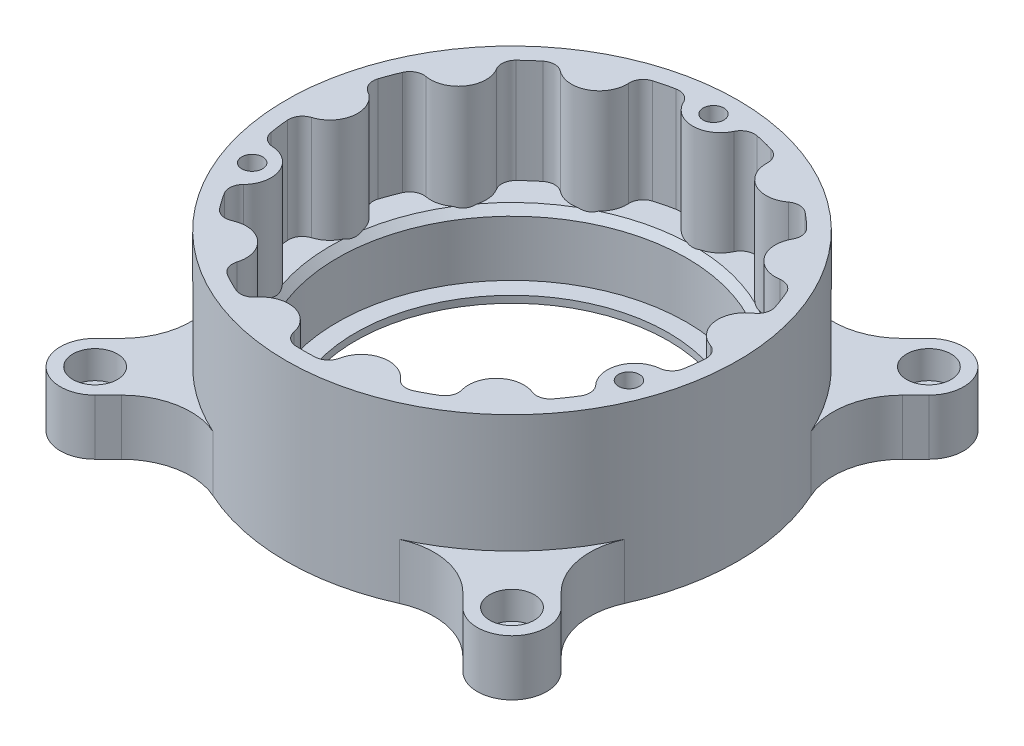
from build123d import *

# Parameters (mm, degrees)
SKETCH1_R           = 32.5
SKETCH1_R_2         = 25.125
BOSS_EXTRUDE1_DEPTH = 9
SKETCH2_R           = 32.5
BOSS_EXTRUDE2_DEPTH = 15
BOSS_EXTRUDE3_START = 1
SKETCH3_R           = 32.5
SKETCH3_R_2         = 22.5
BOSS_EXTRUDE3_DEPTH = 1
SKETCH6_R           = 1.5
CUT_EXTRUDE1_DEPTH  = 8
CHAMFER1_SIZE       = 1
SKETCH7_R           = 1.5
CUT_EXTRUDE2_DEPTH  = 10
SKETCH8_R           = 2.2
BOSS_EXTRUDE4_DEPTH = 8
CUT_EXTRUDE3_START  = -4
SKETCH9_R           = 3.2
SKETCH9_R_2         = 2.2
CUT_EXTRUDE3_DEPTH  = 4


with BuildPart() as part:
    # Sketch1 → Boss-Extrude1 (new body)
    with BuildSketch(Plane(origin=(0, 0, 0), x_dir=(1, 0, 0), z_dir=(0, 1, 0))):
        with Locations(Location((0, 0, 0), (0, 0, 270))):
            Circle(SKETCH1_R)
        with Locations(Location((0, 0, 0), (0, 0, 270))):
            Circle(SKETCH1_R_2, mode=Mode.SUBTRACT)
    extrude(amount=BOSS_EXTRUDE1_DEPTH)

    # Sketch2 → Boss-Extrude2 (add)
    with BuildSketch(Plane(origin=(0, 9, 0), x_dir=(1, 0, 0), z_dir=(0, 1, 0))):
        with Locations(Location((0, 0, 0), (0, 0, 270))):
            Circle(SKETCH2_R)
        with BuildLine():
            ThreePointArc((-25.375540297, 12.992628628), (-26.682507709, 12.788520024), (-27.576202028, 11.813258725))
            ThreePointArc((-27.576202028, 11.813258725), (-28.08632274, 10.543171957), (-28.537981973, 9.251139653))
            ThreePointArc((-28.537981973, 9.251139653), (-28.506017977, 7.926601241), (-27.653144071, 6.912683196))
            ThreePointArc((-27.653144071, 6.912683196), (-25.715566197, 3.004994308), (-28.501905004, -0.350680963))
            ThreePointArc((-28.501905004, -0.350680963), (-29.565571278, -1.14064157), (-29.902062044, -2.422124175))
            ThreePointArc((-29.902062044, -2.422124175), (-29.760395709, -3.78402527), (-29.55673371, -5.138043635))
            ThreePointArc((-29.55673371, -5.138043635), (-28.912687641, -6.292389316), (-27.689232569, -6.792856074))
            ThreePointArc((-27.689232569, -6.792856074), (-24.164380437, -9.34480545), (-25.055107923, -13.604339781))
            ThreePointArc((-25.055107923, -13.604339781), (-25.623509865, -14.797750239), (-25.3233191, -16.085071021))
            ThreePointArc((-25.3233191, -16.085071021), (-24.559413902, -17.228905618), (-23.743881848, -18.336522974))
            ThreePointArc((-23.743881848, -18.336522974), (-22.643370415, -19.055035483), (-21.334530217, -18.935356836))
            ThreePointArc((-21.334530217, -18.935356836), (-17.053259578, -19.562696569), (-15.8477038, -23.718351594))
            ThreePointArc((-15.8477038, -23.718351594), (-15.78770211, -25.031281691), (-14.925767965, -26.023478835))
            ThreePointArc((-14.925767965, -26.023478835), (-13.70757552, -26.685246361), (-12.460110867, -27.290028164))
            ThreePointArc((-12.460110867, -27.290028164), (-11.162191159, -27.41534755), (-10.062885956, -26.714042632))
            ThreePointArc((-10.062885956, -26.714042632), (-6.006174817, -25.308834281), (-3.013433793, -28.386985826))
            ThreePointArc((-3.013433793, -28.386985826), (-2.346463547, -29.507455017), (-1.130634176, -29.978686869))
            ThreePointArc((-1.130634176, -29.978686869), (0.269011361, -29.998793857), (1.668071226, -29.953589741))
            ThreePointArc((1.668071226, -29.953589741), (2.866663541, -29.4681174), (3.517660179, -28.35074982))
            ThreePointArc((3.517660179, -28.35074982), (6.449772908, -25.263196213), (10.503100969, -26.567344966))
            ThreePointArc((10.503100969, -26.567344966), (11.610050121, -27.235903494), (12.894672495, -27.087403368))
            ThreePointArc((12.894672495, -27.087403368), (14.155670345, -26.450274045), (15.385273288, -25.754482442))
            ThreePointArc((15.385273288, -25.754482442), (16.218028064, -24.776571764), (16.284274135, -23.49383981))
            ThreePointArc((16.284274135, -23.49383981), (17.460149184, -19.431184393), (21.624968359, -18.69488798))
            ThreePointArc((21.624968359, -18.69488798), (22.907456533, -18.765696839), (23.968531862, -18.041881287))
            ThreePointArc((23.968531862, -18.041881287), (24.796601794, -16.885749597), (25.568952651, -15.691674873))
            ThreePointArc((25.568952651, -15.691674873), (25.854181872, -14.444088066), (25.324662608, -13.278996696))
            ThreePointArc((25.324662608, -13.278996696), (24.497951908, -9.146735151), (27.830545419, -6.567421958))
            ThreePointArc((27.830545419, -6.567421958), (28.994063974, -6.034455616), (29.596264311, -4.905215472))
            ThreePointArc((29.596264311, -4.905215472), (29.795811373, -3.494227329), (29.928128935, -2.075355018))
            ThreePointArc((29.928128935, -2.075355018), (29.603243622, -0.836988867), (28.593901088, -0.049379292))
            ThreePointArc((28.593901088, -0.049379292), (25.946528984, 3.231499222), (27.708278474, 7.061509876))
            ThreePointArc((27.708278474, 7.061509876), (28.493598385, 8.072634908), (28.504806877, 9.352859717))
            ThreePointArc((28.504806877, 9.352859717), (28.030019575, 10.691959717), (27.492363687, 12.0070787))
            ThreePointArc((27.492363687, 12.0070787), (26.626266262, 12.957446372), (25.360590803, 13.184138003))
            ThreePointArc((25.360590803, 13.184138003), (21.473663534, 14.862737893), (21.271662929, 19.091815445))
            ThreePointArc((21.271662929, 19.091815445), (21.505287491, 20.356229549), (20.920872462, 21.501560302))
            ThreePointArc((20.920872462, 21.501560302), (19.887045308, 22.461198297), (18.809252235, 23.371179482))
            ThreePointArc((18.809252235, 23.371179482), (17.591752027, 23.812768672), (16.358967377, 23.41584327))
            ThreePointArc((16.358967377, 23.41584327), (12.107995006, 23.079194553), (9.968995377, 26.768202421))
            ThreePointArc((9.968995377, 26.768202421), (9.59494417, 28.008119137), (8.539654378, 28.758899546))
            ThreePointArc((8.539654378, 28.758899546), (7.191351989, 29.125323287), (5.827450873, 29.428571429))
            ThreePointArc((5.827450873, 29.428571429), (4.533707828, 29.250070463), (3.625969432, 28.311111111))
            ThreePointArc((3.625969432, 28.311111111), (0, 26), (-3.625969432, 28.311111111))
            ThreePointArc((-3.625969432, 28.311111111), (-4.533707828, 29.250070463), (-5.827450873, 29.428571429))
            ThreePointArc((-5.827450873, 29.428571429), (-7.178556115, 29.128479742), (-8.514382675, 28.766391634))
            ThreePointArc((-8.514382675, 28.766391634), (-9.583131408, 27.998536245), (-9.943401377, 26.732822493))
            ThreePointArc((-9.943401377, 26.732822493), (-12.074887525, 22.960907587), (-16.390567408, 23.342329134))
            ThreePointArc((-16.390567408, 23.342329134), (-17.637578721, 23.762791425), (-18.875899512, 23.317384451))
            ThreePointArc((-18.875899512, 23.317384451), (-19.923687981, 22.428701639), (-20.929689442, 21.49297792))
            ThreePointArc((-20.929689442, 21.49297792), (-21.518876674, 20.308628924), (-21.239932465, 19.015565017))
            ThreePointArc((-21.239932465, 19.015565017), (-21.353557542, 14.662273368), (-25.375540297, 12.992628628))
        make_face(mode=Mode.SUBTRACT)
    extrude(amount=BOSS_EXTRUDE2_DEPTH)

    # Sketch3 → Boss-Extrude3 (add)
    with BuildSketch(Plane(origin=(0, 0, 0), x_dir=(-1, 0, 0), z_dir=(0, -1, 0)).offset(BOSS_EXTRUDE3_START)):
        with Locations(Location((0, 0, 0), (0, 0, 90))):
            Circle(SKETCH3_R)
        with Locations(Location((0, 0, 0), (0, 0, 90))):
            Circle(SKETCH3_R_2, mode=Mode.SUBTRACT)
    extrude(amount=-BOSS_EXTRUDE3_DEPTH)

    # Sketch6 → Cut-Extrude1 (cut)
    with BuildSketch(Plane(origin=(0, -1, 0), x_dir=(-1, 0, 0), z_dir=(0, -1, 0))):
        with Locations(Location((0, -27.5, 0), (0, 0, 90))):
            Circle(SKETCH6_R)
        with Locations(Location((-19.445436483, -19.445436483, 0), (0, 0, 90))):
            Circle(SKETCH6_R)
        with Locations(Location((-27.5, 0, 0), (0, 0, 90))):
            Circle(SKETCH6_R)
        with Locations(Location((-19.445436483, 19.445436483, 0), (0, 0, 90))):
            Circle(SKETCH6_R)
        with Locations(Location((0, 27.5, 0), (0, 0, 90))):
            Circle(SKETCH6_R)
        with Locations(Location((19.445436483, 19.445436483, 0), (0, 0, 90))):
            Circle(SKETCH6_R)
        with Locations(Location((27.5, 0, 0), (0, 0, 90))):
            Circle(SKETCH6_R)
        with Locations(Location((19.445436483, -19.445436483, 0), (0, 0, 90))):
            Circle(SKETCH6_R)
    extrude(amount=-CUT_EXTRUDE1_DEPTH, mode=Mode.SUBTRACT)

    # Chamfer1
    # the kernel refuses this chamfer: 1 mm, written as the material it takes off along each edge
    with BuildSketch(Plane(origin=(0, 9, 0), x_dir=(0, 0, 1), z_dir=(-1, 0, 0))) as chamfer1_piece_1_section:
        Polygon((25.125 + CHAMFER1_SIZE, 0), (25.125, -CHAMFER1_SIZE), (25.125, 0), align=None)
    chamfer1_piece_1 = revolve(axis=Axis((0, 9, 0), (0, 1, 0)), mode=Mode.PRIVATE)
    chamfer1_piece_1 = chamfer1_piece_1 - Plane(origin=(20.133645602, 8.530446202, 22.406485538), x_dir=(-0.9623428666303805, 0, 0.27183856798773404), z_dir=(0, -1, 0)) * Cylinder(4, 105, mode=Mode.PRIVATE)
    chamfer1_piece_1 = chamfer1_piece_1 - Plane(origin=(7.439247582, 8.530446202, 29.138881942), x_dir=(-0.9803968506900749, 0, -0.1970330306242669), z_dir=(0, -1, 0)) * Cylinder(4, 105, mode=Mode.PRIVATE)
    chamfer1_piece_1 = chamfer1_piece_1 - Plane(origin=(-6.92978425, 8.530446202, 29.20074199), x_dir=(-0.7832754265463859, 0, -0.6216748395814143), z_dir=(0, -1, 0)) * Cylinder(4, 105, mode=Mode.PRIVATE)
    chamfer1_piece_1 = chamfer1_piece_1 - Plane(origin=(-19.681677866, 8.530446202, 22.577894291), x_dir=(-0.4132130876365111, 0, -0.9106343636201639), z_dir=(0, -1, 0)) * Cylinder(4, 105, mode=Mode.PRIVATE)
    chamfer1_piece_1 = chamfer1_piece_1 - Plane(origin=(-27.895128116, 8.530446202, 10.787553437), x_dir=(0.05147388661387087, 0, -0.9986743408122902), z_dir=(0, -1, 0)) * Cylinder(4, 105, mode=Mode.PRIVATE)
    chamfer1_piece_1 = chamfer1_piece_1 - Plane(origin=(-29.68853253, 8.530446202, -3.469255569), x_dir=(0.5088471146837801, 0, -0.8608569067376948), z_dir=(0, -1, 0)) * Cylinder(4, 105, mode=Mode.PRIVATE)
    chamfer1_piece_1 = chamfer1_piece_1 - Plane(origin=(-24.65104377, 8.530446202, -16.926469599), x_dir=(0.8527778262980071, 0, -0.5222738543852701), z_dir=(0, -1, 0)) * Cylinder(4, 105, mode=Mode.PRIVATE)
    chamfer1_piece_1 = chamfer1_piece_1 - Plane(origin=(-13.936689803, 8.530446202, -26.501203095), x_dir=(0.9983221065340072, 0, -0.05790484958535382), z_dir=(0, -1, 0)) * Cylinder(4, 105, mode=Mode.PRIVATE)
    chamfer1_piece_1 = chamfer1_piece_1 - Plane(origin=(0, 8.530446202, -30), x_dir=(0.9064923579720502, 0, 0.4222222222222233), z_dir=(0, -1, 0)) * Cylinder(4, 105, mode=Mode.PRIVATE)
    chamfer1_piece_1 = chamfer1_piece_1 - Plane(origin=(13.96629796, 8.530446202, -26.62132811), x_dir=(0.5981673543401665, 0, 0.8013712099905297), z_dir=(0, -1, 0)) * Cylinder(4, 105, mode=Mode.PRIVATE)
    chamfer1_piece_1 = chamfer1_piece_1 - Plane(origin=(24.762693526, 8.530446202, -17.139200436), x_dir=(0.14947431915059115, 0, 0.9887656081774221), z_dir=(0, -1, 0)) * Cylinder(4, 105, mode=Mode.PRIVATE)
    add(chamfer1_piece_1, mode=Mode.SUBTRACT)

    # Sketch7 → Cut-Extrude2 (cut)
    with BuildSketch(Plane(origin=(0, 24, 0), x_dir=(1, 0, 0), z_dir=(0, 1, 0))):
        with Locations(Location((0, 29, 0), (0, 0, 270))):
            Circle(SKETCH7_R)
        with Locations(Location((-27.115471038, -10.283541724, 0), (0, 0, 270))):
            Circle(SKETCH7_R)
        with Locations(Location((27.115471038, -10.283541724, 0), (0, 0, 270))):
            Circle(SKETCH7_R)
    extrude(amount=-CUT_EXTRUDE2_DEPTH, mode=Mode.SUBTRACT)

    # Sketch8 → Boss-Extrude4 (add)
    # profile 1 of 4: a face of its own
    with BuildSketch(Plane.XZ.offset(1)):
        with BuildLine():
            Line((-33.535533906, 26.464466094), (-31.653588604, 24.582520792))
            ThreePointArc((-31.653588604, 24.582520792), (-28.886858103, 19.305254628), (-29.612972553, 13.391111103))
            ThreePointArc((-29.612972553, 13.391111103), (-22.980970389, 22.980970389), (-13.391111103, 29.612972553))
            ThreePointArc((-13.391111103, 29.612972553), (-19.305254628, 28.886858103), (-24.582520792, 31.653588604))
            Line((-24.582520792, 31.653588604), (-26.464466094, 33.535533906))
            ThreePointArc((-26.464466094, 33.535533906), (-33.535533906, 33.535533906), (-33.535533906, 26.464466094))
        make_face()
        with Locations(Location((-30, 30, 0), (0, 0, 270))):
            Circle(SKETCH8_R, mode=Mode.SUBTRACT)
    # profile 2 of 4: a face of its own
    with BuildSketch(Plane.XZ.offset(1)):
        with BuildLine():
            Line((26.464466094, 33.535533906), (24.582520792, 31.653588604))
            ThreePointArc((24.582520792, 31.653588604), (19.305254628, 28.886858103), (13.391111103, 29.612972553))
            ThreePointArc((13.391111103, 29.612972553), (22.980970389, 22.980970389), (29.612972553, 13.391111103))
            ThreePointArc((29.612972553, 13.391111103), (28.886858103, 19.305254628), (31.653588604, 24.582520792))
            Line((31.653588604, 24.582520792), (33.535533906, 26.464466094))
            ThreePointArc((33.535533906, 26.464466094), (33.535533906, 33.535533906), (26.464466094, 33.535533906))
        make_face()
        with Locations(Location((30, 30, 0), (0, 0, 270))):
            Circle(SKETCH8_R, mode=Mode.SUBTRACT)
    # profile 3 of 4: a face of its own
    with BuildSketch(Plane.XZ.offset(1)):
        with BuildLine():
            Line((33.535533906, -26.464466094), (31.653588604, -24.582520792))
            ThreePointArc((31.653588604, -24.582520792), (28.886858103, -19.305254628), (29.612972553, -13.391111103))
            ThreePointArc((29.612972553, -13.391111103), (22.980970389, -22.980970389), (13.391111103, -29.612972553))
            ThreePointArc((13.391111103, -29.612972553), (19.305254628, -28.886858103), (24.582520792, -31.653588604))
            Line((24.582520792, -31.653588604), (26.464466094, -33.535533906))
            ThreePointArc((26.464466094, -33.535533906), (33.535533906, -33.535533906), (33.535533906, -26.464466094))
        make_face()
        with Locations(Location((30, -30, 0), (0, 0, 270))):
            Circle(SKETCH8_R, mode=Mode.SUBTRACT)
    # profile 4 of 4: a face of its own
    with BuildSketch(Plane.XZ.offset(1)):
        with BuildLine():
            Line((-26.464466094, -33.535533906), (-24.582520792, -31.653588604))
            ThreePointArc((-24.582520792, -31.653588604), (-19.305254628, -28.886858103), (-13.391111103, -29.612972553))
            ThreePointArc((-13.391111103, -29.612972553), (-22.980970389, -22.980970389), (-29.612972553, -13.391111103))
            ThreePointArc((-29.612972553, -13.391111103), (-28.886858103, -19.305254628), (-31.653588604, -24.582520792))
            Line((-31.653588604, -24.582520792), (-33.535533906, -26.464466094))
            ThreePointArc((-33.535533906, -26.464466094), (-33.535533906, -33.535533906), (-26.464466094, -33.535533906))
        make_face()
        with Locations(Location((-30, -30, 0), (0, 0, 270))):
            Circle(SKETCH8_R, mode=Mode.SUBTRACT)
    extrude(amount=-BOSS_EXTRUDE4_DEPTH)

    # Sketch9 → Cut-Extrude3 (cut)
    # profile 1 of 4: a face of its own
    with BuildSketch(Plane(origin=(0, 7, 0), x_dir=(1, 0, 0), z_dir=(0, 1, 0)).offset(CUT_EXTRUDE3_START)):
        with Locations(Location((-30, -30, 0), (0, 0, 270))):
            Circle(SKETCH9_R)
        with Locations(Location((-30, -30, 0), (0, 0, 90))):
            Circle(SKETCH9_R_2, mode=Mode.SUBTRACT)
    # profile 2 of 4: a face of its own
    with BuildSketch(Plane(origin=(0, 7, 0), x_dir=(1, 0, 0), z_dir=(0, 1, 0)).offset(CUT_EXTRUDE3_START)):
        with Locations(Location((30, -30, 0), (0, 0, 270))):
            Circle(SKETCH9_R)
        with Locations(Location((30, -30, 0), (0, 0, 90))):
            Circle(SKETCH9_R_2, mode=Mode.SUBTRACT)
    # profile 3 of 4: a face of its own
    with BuildSketch(Plane(origin=(0, 7, 0), x_dir=(1, 0, 0), z_dir=(0, 1, 0)).offset(CUT_EXTRUDE3_START)):
        with Locations(Location((30, 30, 0), (0, 0, 270))):
            Circle(SKETCH9_R)
        with Locations(Location((30, 30, 0), (0, 0, 90))):
            Circle(SKETCH9_R_2, mode=Mode.SUBTRACT)
    # profile 4 of 4: a face of its own
    with BuildSketch(Plane(origin=(0, 7, 0), x_dir=(1, 0, 0), z_dir=(0, 1, 0)).offset(CUT_EXTRUDE3_START)):
        with Locations(Location((-30, 30, 0), (0, 0, 270))):
            Circle(SKETCH9_R)
        with Locations(Location((-30, 30, 0), (0, 0, 90))):
            Circle(SKETCH9_R_2, mode=Mode.SUBTRACT)
    extrude(amount=CUT_EXTRUDE3_DEPTH, mode=Mode.SUBTRACT)


solid = part.part
